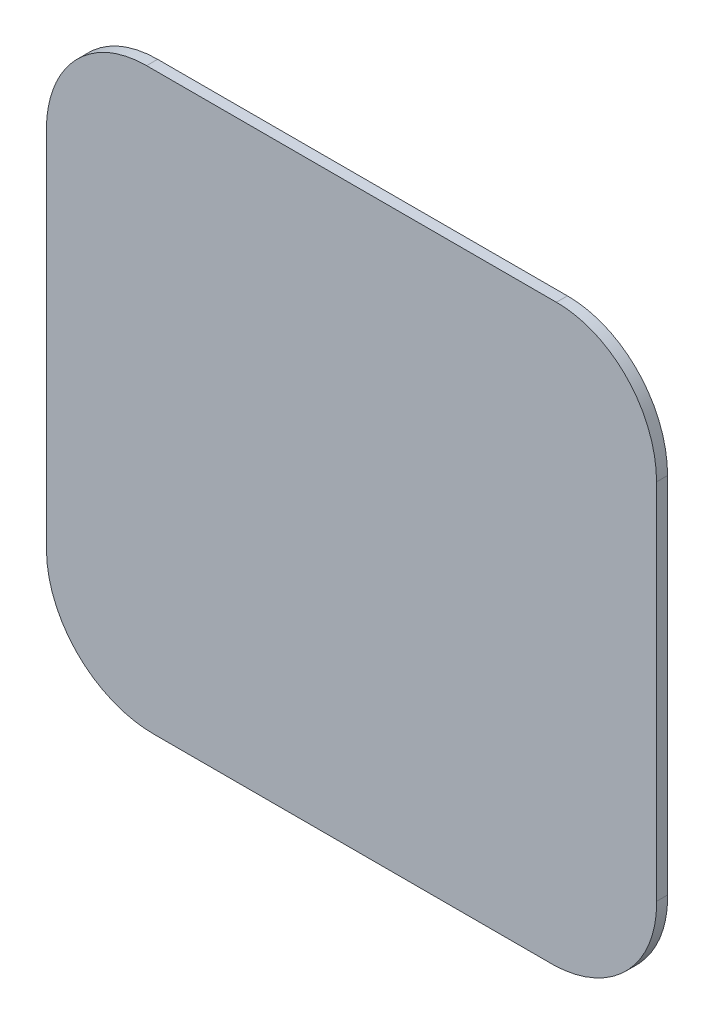
from build123d import *

# Parameters (mm, degrees)
SKETCH1_W               = 208.77467438
SKETCH1_H               = 197.406670985
BOSS_EXTRUDE1_DEPTH     = 3
CUT_EXTRUDE1_DEPTH      = 164.40940796
CUT_EXTRUDE1_DEPTH_BACK = 164.40940796
SKETCH3_OUTSIDE_W       = 268.242
SKETCH3_OUTSIDE_H       = 256.875


with BuildPart() as part:
    # Sketch1 → Boss-Extrude1 (new body)
    with BuildSketch(Plane.XY):
        with Locations((-0.931028509, 26.203335493)):
            Rectangle(SKETCH1_W, SKETCH1_H)
    extrude(amount=BOSS_EXTRUDE1_DEPTH)

    # Sketch3 outside → Cut-Extrude1 (cut, two sides: drawn at the far end of the back side and taken through both)
    with BuildSketch(Plane.XY.offset(3).offset(-CUT_EXTRUDE1_DEPTH_BACK)):
        with Locations((-0.931, 26.2035)):
            Rectangle(SKETCH3_OUTSIDE_W, SKETCH3_OUTSIDE_H)
        with BuildLine():
            Line((-83, -42.5), (-83, 56.32702739))
            add(Edge.make_bspline(
                [(-83, 56.32702739), (-82.998682474, 58.176942859), (-82.834840503, 59.999663938), (-82.350302436, 62.69379253), (-82.148656089, 63.585120033), (-81.784047033, 64.911713794), (-81.652137089, 65.352175954), (-81.367023494, 66.229537306), (-81.213562352, 66.666953654), (-80.400483999, 68.821975051), (-79.599523855, 70.461918085), (-78.171181501, 72.795075749), (-77.657010243, 73.551534684), (-76.549184114, 75.020049732), (-75.953178502, 75.733885545), (-74.084207475, 77.757428632), (-72.719882703, 78.967056331), (-70.493295655, 80.569352856), (-69.720123025, 81.068294373), (-68.113309897, 81.989515441), (-67.293132427, 82.404171632), (-64.783810835, 83.514451851), (-63.046345521, 84.07766987), (-60.791647516, 84.554628375), (-60.335446233, 84.63870716), (-59.42168329, 84.782336222), (-58.963840003, 84.842013868), (-57.587454375, 84.985010615), (-56.666063193, 85.032380969), (-55.740865612, 85.031719377)],
                knots=[0, 0, 0, 0, 0.125, 0.125, 0.1875, 0.1875, 0.21875, 0.21875, 0.25, 0.25, 0.375, 0.375, 0.4375, 0.4375, 0.5, 0.5, 0.625, 0.625, 0.6875, 0.6875, 0.75, 0.75, 0.875, 0.875, 0.90625, 0.90625, 0.9375, 0.9375, 1, 1, 1, 1], degree=3))
            Line((-55.740865612, 85.031719377), (55.740865612, 85.031719377))
            add(Edge.make_bspline(
                [(55.740865612, 85.031719377), (57.587017126, 85.03304159), (59.404327256, 84.844490853), (62.087837775, 84.282170727), (62.975214965, 84.047815643), (64.735216304, 83.481981035), (65.596920663, 83.153736501), (68.108256937, 82.045376467), (69.693969394, 81.139865272), (71.565149643, 79.799117061), (71.934808313, 79.519586674), (72.656456536, 78.944165104), (73.008557866, 78.64830254), (74.039340206, 77.736863863), (75.345780593, 76.458123385), (76.520109542, 75.055919601), (77.628393105, 73.591993821), (78.151713111, 72.825125275), (79.594804656, 70.473024888), (80.39559947, 68.831000354), (81.366869679, 66.262520006), (81.652268079, 65.387817744), (82.143806978, 63.605979128), (82.347164388, 62.709267237), (82.835030225, 60.002440773), (82.998681158, 58.175819637), (83, 56.32702739)],
                knots=[0, 0, 0, 0, 0.125, 0.125, 0.1875, 0.1875, 0.25, 0.25, 0.375, 0.375, 0.40625, 0.40625, 0.4375, 0.4375, 0.5, 0.5625, 0.5625, 0.625, 0.625, 0.75, 0.75, 0.8125, 0.8125, 0.875, 0.875, 1, 1, 1, 1], degree=3))
            Line((83, 56.32702739), (83, -42.5))
            add(Edge.make_bspline(
                [(83, -42.5), (83.032920102, -44.386862358), (82.878883698, -46.245203536), (82.378988181, -48.991702234), (82.167214427, -49.900315168), (81.651325284, -51.703453844), (81.345833372, -52.600021126), (80.309832535, -55.209707544), (79.456464621, -56.863013426), (78.188310068, -58.822565996), (77.924516043, -59.209074211), (77.376279141, -59.971114554), (77.090993735, -60.347669544), (76.210930009, -61.45129269), (75.592331146, -62.152532222), (73.643859034, -64.155962628), (72.222184311, -65.358811167), (70.288122072, -66.69250909), (69.892471815, -66.951194506), (69.093317003, -67.446036453), (68.689085443, -67.682756966), (67.462682958, -68.36140261), (65.79098978, -69.182368876), (64.047401625, -69.838039931), (62.712380812, -70.266958959), (62.262810926, -70.3994412), (61.354382401, -70.643049721), (60.895142343, -70.754198807), (58.596498873, -71.25117482), (56.733837637, -71.467086815), (54.847256094, -71.5)],
                knots=[0, 0, 0, 0, 0.125, 0.125, 0.1875, 0.1875, 0.25, 0.25, 0.375, 0.375, 0.40625, 0.40625, 0.4375, 0.4375, 0.5, 0.5, 0.625, 0.625, 0.65625, 0.65625, 0.6875, 0.6875, 0.75, 0.8125, 0.8125, 0.84375, 0.84375, 0.875, 0.875, 1, 1, 1, 1], degree=3))
            Line((54.847256094, -71.5), (-53.846971432, -71.5))
            add(Edge.make_bspline(
                [(-83, -42.5), (-83, -44.419970407), (-82.810318727, -46.307608456), (-82.25303923, -49.092572296), (-82.02147982, -50.013086752), (-81.464674337, -51.838146187), (-81.137992532, -52.74474097), (-80.037780814, -55.381005459), (-79.1403328, -57.047650207), (-77.815504271, -59.018454697), (-77.540296046, -59.406939767), (-76.969069469, -60.172378105), (-76.672175857, -60.55035685), (-75.757339376, -61.657364995), (-75.115621666, -62.35970135), (-73.097976166, -64.363051694), (-71.630428367, -65.561384642), (-69.639334981, -66.883729225), (-69.232270827, -67.139847415), (-68.410556707, -67.629025905), (-67.995155179, -67.862648194), (-66.735565792, -68.531214139), (-65.02048324, -69.336651084), (-63.235199194, -69.972674014), (-61.869549932, -70.385290576), (-61.409877996, -70.512077139), (-60.481464012, -70.743761788), (-60.012335748, -70.848675789), (-57.665254344, -71.313421011), (-55.766656302, -71.5), (-53.846971432, -71.5)],
                knots=[0, 0, 0, 0, 0.125, 0.125, 0.1875, 0.1875, 0.25, 0.25, 0.375, 0.375, 0.40625, 0.40625, 0.4375, 0.4375, 0.5, 0.5, 0.625, 0.625, 0.65625, 0.65625, 0.6875, 0.6875, 0.75, 0.8125, 0.8125, 0.84375, 0.84375, 0.875, 0.875, 1, 1, 1, 1], degree=3))
        make_face(mode=Mode.SUBTRACT)
    extrude(amount=CUT_EXTRUDE1_DEPTH + CUT_EXTRUDE1_DEPTH_BACK, mode=Mode.SUBTRACT)


solid = part.part
